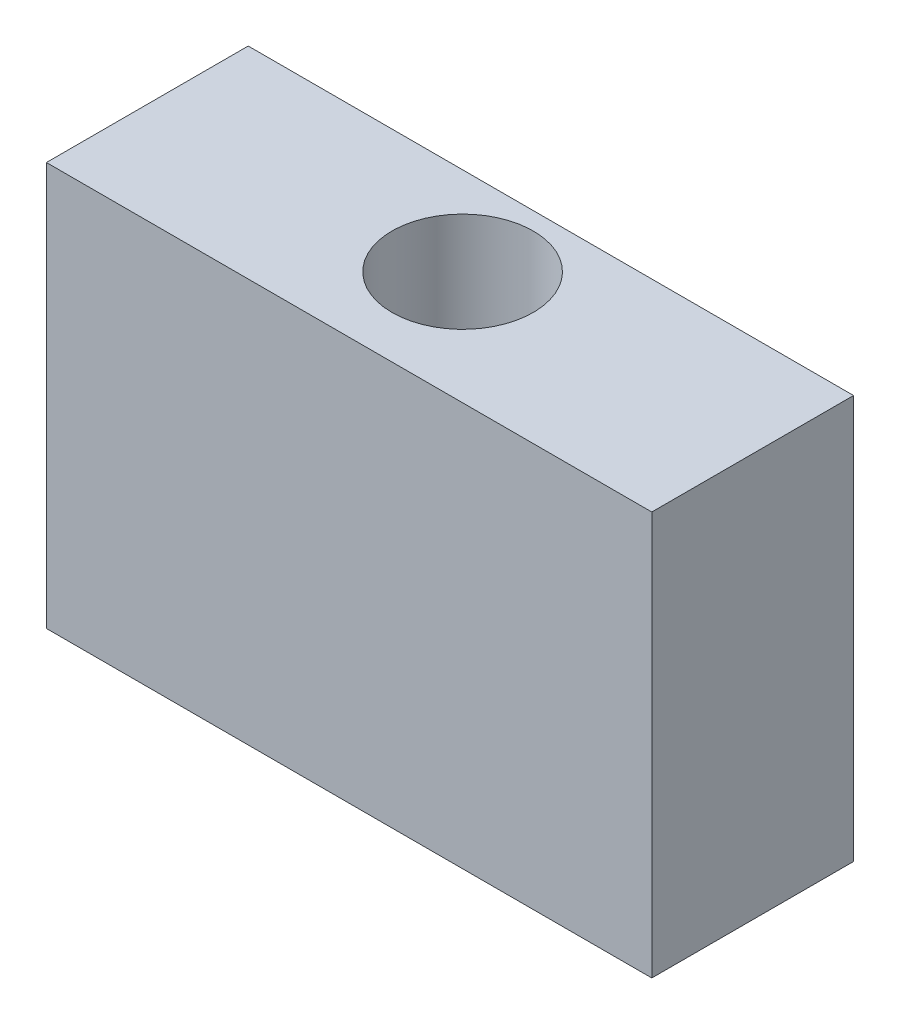
from build123d import *

# Parameters (mm, degrees)
SKETCH1_W           = 38.1
SKETCH1_H           = 12.7
SKETCH1_R           = 4.445
BOSS_EXTRUDE1_DEPTH = 25.4


with BuildPart() as part:
    # Sketch1 → Boss-Extrude1 (new body)
    with BuildSketch(Plane(origin=(0, 0, 0), x_dir=(1, 0, 0), z_dir=(0, 1, 0))):
        with Locations((19.05, 6.35)):
            Rectangle(SKETCH1_W, SKETCH1_H)
        with Locations((19.05, 7.14375)):
            Circle(SKETCH1_R, mode=Mode.SUBTRACT)
    extrude(amount=BOSS_EXTRUDE1_DEPTH)


solid = part.part
